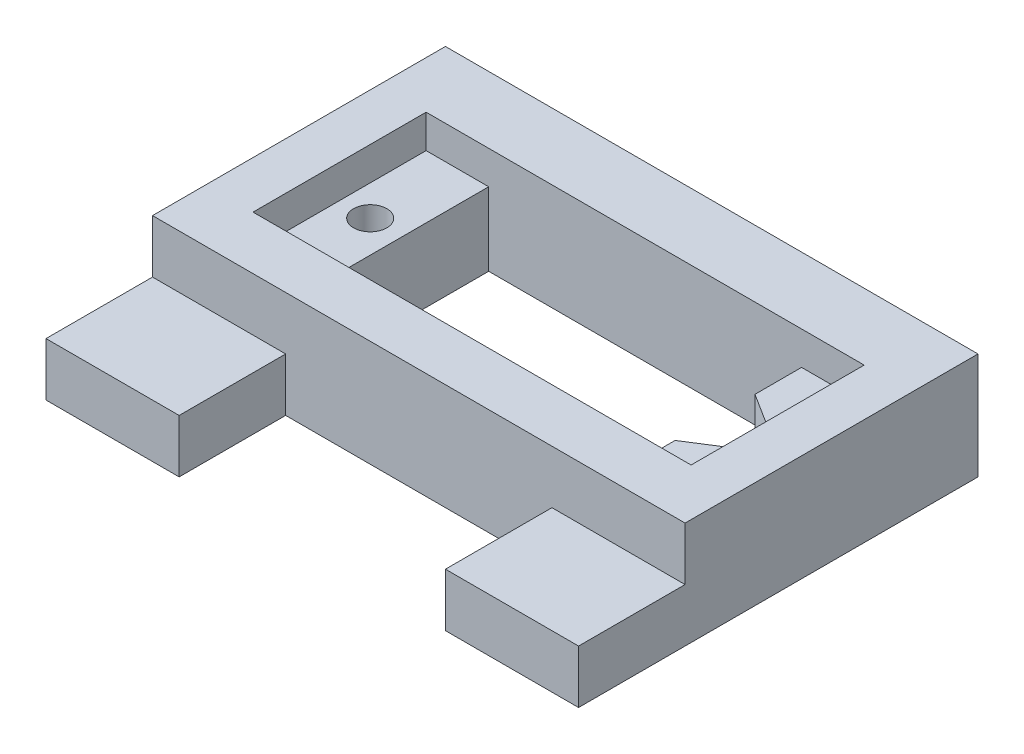
from build123d import *

# Parameters (mm, degrees)
SKETCH1_W               = 23.5
SKETCH1_H               = 13
BOSS_EXTRUDE1_DEPTH     = 8
SKETCH2_W               = 40
SKETCH2_H               = 8
CUT_EXTRUDE1_DEPTH      = 4
CUT_EXTRUDE2_DEPTH      = 37.715970639
CUT_EXTRUDE2_DEPTH_BACK = 37.715970639
SKETCH3_W               = 20
SKETCH3_H               = 8
SKETCH4_W               = 4.7
SKETCH4_H               = 13
SKETCH4_R               = 1.25
CUT_EXTRUDE3_DEPTH      = 2.5
CUT_EXTRUDE4_DEPTH      = 38.363919762
CUT_EXTRUDE4_DEPTH_BACK = 38.363919762
SKETCH5_R               = 1.25
CUT_EXTRUDE5_DEPTH      = 37.909517743
CUT_EXTRUDE5_DEPTH_BACK = 37.909517743


with BuildPart() as part:
    # Sketch1 → Boss-Extrude1 (new body)
    with BuildSketch(Plane(origin=(0, 0, 0), x_dir=(1, 0, 0), z_dir=(0, 1, 0))):
        Polygon((-8.25, 18), (31.75, 18), (31.75, -4), (31.75, -12), (21.75, -12), (1.75, -12), (-8.25, -12), (-8.25, -4), align=None)
        with Locations((11.75, 6.5)):
            Rectangle(SKETCH1_W, SKETCH1_H, mode=Mode.SUBTRACT)
    extrude(amount=BOSS_EXTRUDE1_DEPTH)

    # Sketch2 → Cut-Extrude1 (cut)
    with BuildSketch(Plane(origin=(0, 8, 0), x_dir=(1, 0, 0), z_dir=(0, 1, 0))):
        with Locations((11.75, -8)):
            Rectangle(SKETCH2_W, SKETCH2_H)
    extrude(amount=-CUT_EXTRUDE1_DEPTH, mode=Mode.SUBTRACT)

    # Sketch3 → Cut-Extrude2 (cut, two sides: drawn at the far end of the back side and taken through both)
    with BuildSketch(Plane(origin=(0, 4, 0), x_dir=(1, 0, 0), z_dir=(0, 1, 0)).offset(-CUT_EXTRUDE2_DEPTH_BACK)):
        with Locations((11.75, -8)):
            Rectangle(SKETCH3_W, SKETCH3_H)
    extrude(amount=CUT_EXTRUDE2_DEPTH + CUT_EXTRUDE2_DEPTH_BACK, mode=Mode.SUBTRACT)

    # Sketch4 → Cut-Extrude3 (cut)
    # profile 1 of 2: a face of its own
    with BuildSketch(Plane(origin=(0, 8, 0), x_dir=(1, 0, 0), z_dir=(0, 1, 0))):
        with Locations((-2.35, 6.5)):
            Rectangle(SKETCH4_W, SKETCH4_H)
        with Locations((-2.4, 6.5)):
            Circle(SKETCH4_R, mode=Mode.SUBTRACT)
    # profile 2 of 2: a face of its own
    with BuildSketch(Plane(origin=(0, 8, 0), x_dir=(1, 0, 0), z_dir=(0, 1, 0))):
        with Locations((25.85, 6.5)):
            Rectangle(SKETCH4_W, SKETCH4_H)
        with Locations((25.9, 6.5)):
            Circle(SKETCH4_R, mode=Mode.SUBTRACT)
    extrude(amount=-CUT_EXTRUDE3_DEPTH, mode=Mode.SUBTRACT)

    # Sketch5 → Cut-Extrude4 (cut, two sides: drawn at the far end of the back side and taken through both)
    with BuildSketch(Plane(origin=(0, 8, 0), x_dir=(1, 0, 0), z_dir=(0, 1, 0)).offset(-CUT_EXTRUDE4_DEPTH_BACK)):
        with Locations((-2.4, 6.5)):
            Circle(SKETCH5_R)
        with Locations((25.9, 6.5)):
            Circle(SKETCH5_R)
    extrude(amount=CUT_EXTRUDE4_DEPTH + CUT_EXTRUDE4_DEPTH_BACK, mode=Mode.SUBTRACT)

    # Sketch6 → Cut-Extrude5 (cut, two sides: drawn at the far end of the back side and taken through both)
    with BuildSketch(Plane(origin=(0, 5.5, 0), x_dir=(1, 0, 0), z_dir=(0, 1, 0)).offset(-CUT_EXTRUDE5_DEPTH_BACK)):
        with BuildLine():
            Line((23.5, 9.5), (26.568911676, 7.555962674))
            ThreePointArc((26.568911676, 7.555962674), (27.15, 6.5), (26.568911676, 5.444037326))
            Line((26.568911676, 5.444037326), (23.5, 3.5))
            Line((23.5, 3.5), (23.5, 9.5))
        make_face()
    extrude(amount=CUT_EXTRUDE5_DEPTH + CUT_EXTRUDE5_DEPTH_BACK, mode=Mode.SUBTRACT)


solid = part.part
